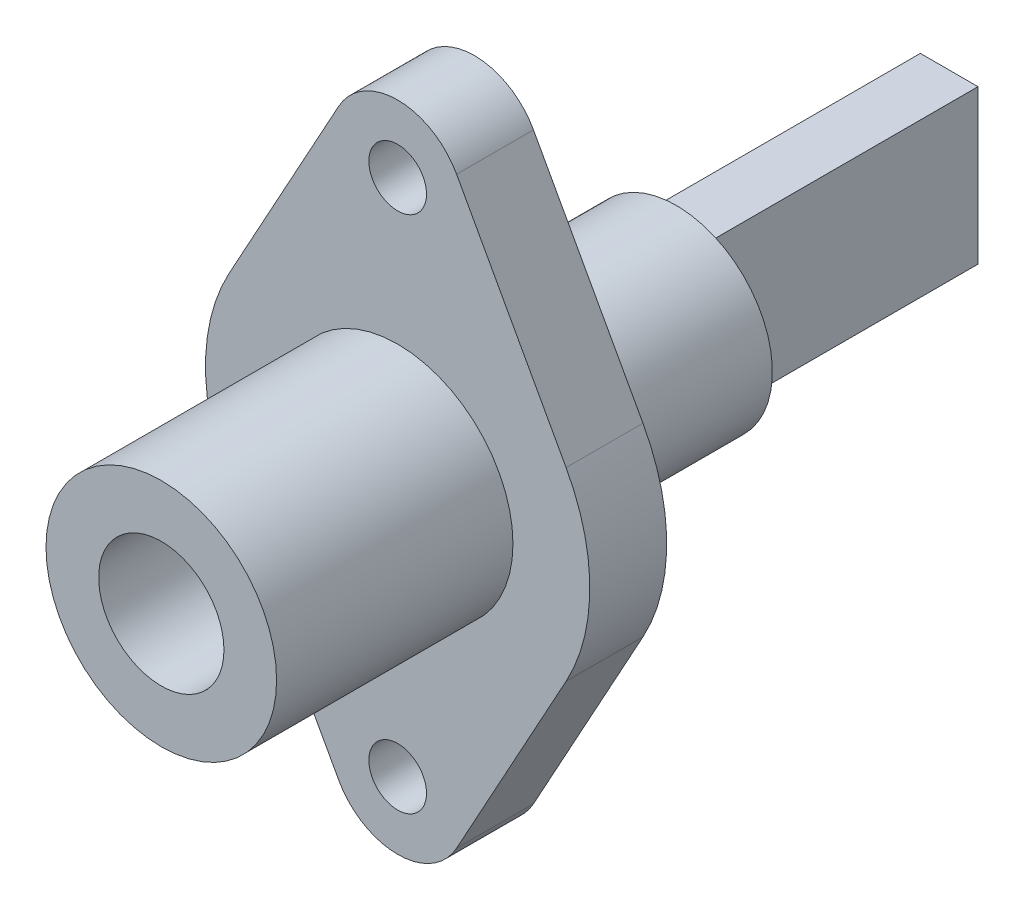
from build123d import *

# Parameters (mm, degrees)
SKETCH1_R           = 1.5
BOSS_EXTRUDE1_DEPTH = 4
SKETCH2_R           = 6
BOSS_EXTRUDE2_DEPTH = 12.3
SKETCH3_R           = 7.5
BOSS_EXTRUDE3_DEPTH = 0.5
SKETCH4_W           = 3
SKETCH4_H           = 8
BOSS_EXTRUDE4_DEPTH = 24.2
SKETCH5_R           = 5
BOSS_EXTRUDE5_DEPTH = 10
SKETCH6_R           = 3.26
CUT_EXTRUDE1_DEPTH  = 10


with BuildPart() as part:
    # Sketch1 → Boss-Extrude1 (new body)
    with BuildSketch(Plane.XY):
        with BuildLine():
            Line((-3.067596925, 15.185185185), (-8.764562642, 4.814814815))
            ThreePointArc((-8.764562642, 4.814814815), (-10, 0), (-8.764562642, -4.814814815))
            Line((-8.764562642, -4.814814815), (-3.067596925, -15.185185185))
            ThreePointArc((-3.067596925, -15.185185185), (0, -17), (3.067596925, -15.185185185))
            Line((3.067596925, -15.185185185), (8.764562642, -4.814814815))
            ThreePointArc((8.764562642, -4.814814815), (10, 0), (8.764562642, 4.814814815))
            Line((8.764562642, 4.814814815), (3.067596925, 15.185185185))
            ThreePointArc((3.067596925, 15.185185185), (0, 17), (-3.067596925, 15.185185185))
        make_face()
        with Locations((0, 13.5)):
            Circle(SKETCH1_R, mode=Mode.SUBTRACT)
        with Locations((0, -13.5)):
            Circle(SKETCH1_R, mode=Mode.SUBTRACT)
    extrude(amount=BOSS_EXTRUDE1_DEPTH)

    # Sketch2 → Boss-Extrude2 (add)
    with BuildSketch(Plane.XY.offset(4)):
        Circle(SKETCH2_R)
    extrude(amount=BOSS_EXTRUDE2_DEPTH)

    # Sketch3 → Boss-Extrude3 (add)
    with BuildSketch(Plane(origin=(0, 0, 0), x_dir=(-1, 0, 0), z_dir=(0, 0, -1))):
        Circle(SKETCH3_R)
    extrude(amount=BOSS_EXTRUDE3_DEPTH)

    # Sketch4 → Boss-Extrude4 (add)
    with BuildSketch(Plane(origin=(0, 0, -0.5), x_dir=(-1, 0, 0), z_dir=(0, 0, -1))):
        Rectangle(SKETCH4_W, SKETCH4_H)
    extrude(amount=BOSS_EXTRUDE4_DEPTH)

    # Sketch5 → Boss-Extrude5 (add)
    with BuildSketch(Plane(origin=(0, 0, -0.5), x_dir=(-1, 0, 0), z_dir=(0, 0, -1))):
        Circle(SKETCH5_R)
    extrude(amount=BOSS_EXTRUDE5_DEPTH)

    # Sketch6 → Cut-Extrude1 (cut)
    with BuildSketch(Plane.XY.offset(16.3)):
        Circle(SKETCH6_R)
    extrude(amount=-CUT_EXTRUDE1_DEPTH, mode=Mode.SUBTRACT)


solid = part.part
